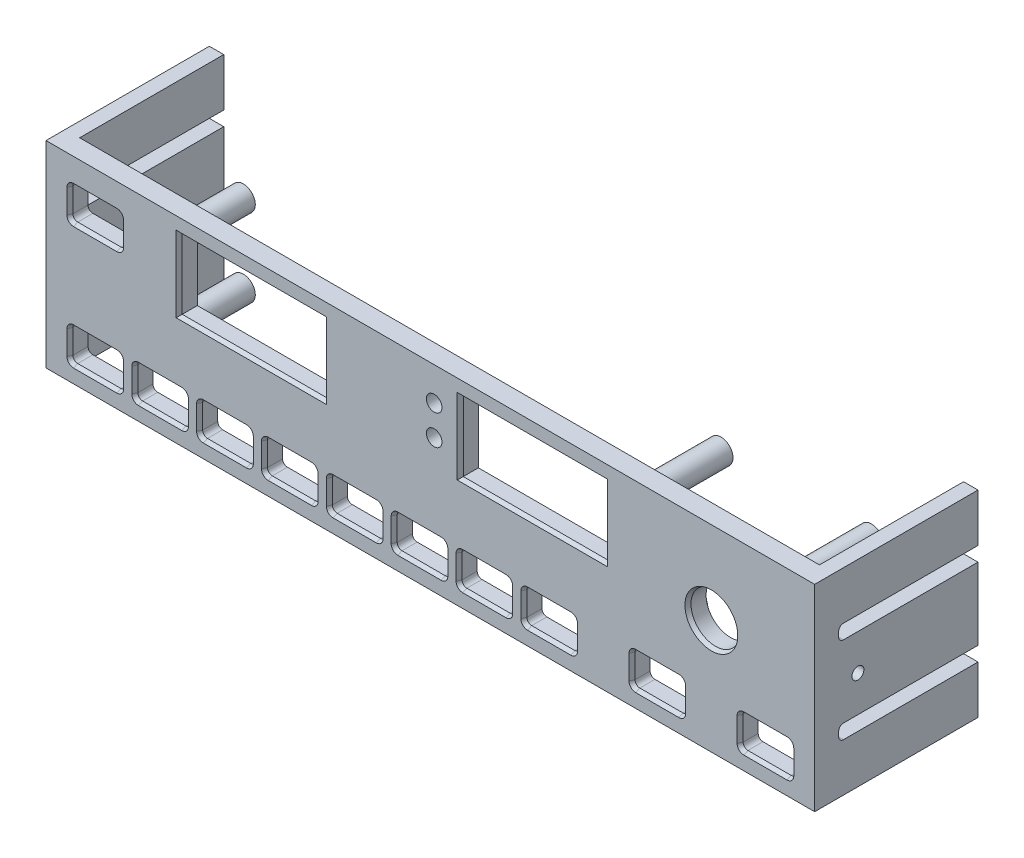
from build123d import *

# Parameters (mm, degrees)
ESQUISSE1_W             = 160
ESQUISSE1_H             = 41
BOSS_EXTRU_1_DEPTH      = 4
ESQUISSE2_R             = 5.1
ESQUISSE2_R_2           = 1.625
ESQUISSE2_W             = 30.5
ESQUISSE2_H             = 15
ENL_V_MAT_EXTRU_1_DEPTH = 4
ESQUISSE4_W             = 3
ESQUISSE4_H             = 41
BOSS_EXTRU_2_DEPTH      = 30
ENL_V_MAT_EXTRU_2_DEPTH = 168.871975029
ESQUISSE7_R             = 2.5
ESQUISSE7_R_2           = 1.25
BOSS_EXTRU_3_DEPTH      = 15
CHANFREIN1_SIZE         = 0.4
CHANFREIN1_SIZE2        = 0.857802768
ESQUISSE9_R             = 1.25
ENL_V_MAT_EXTRU_3_DEPTH = 900


with BuildPart() as part:
    # Esquisse1 → Boss.-Extru.1 (new body)
    with BuildSketch(Plane.XY):
        with Locations((80, 20.5)):
            Rectangle(ESQUISSE1_W, ESQUISSE1_H)
    extrude(amount=BOSS_EXTRU_1_DEPTH)

    # Esquisse2 → Enlèv. mat.-Extru.1 (cut)
    with BuildSketch(Plane.XY.offset(4)):
        with Locations((138.5, 23.75)):
            Circle(ESQUISSE2_R)
        with Locations((80.8, 34.05)):
            Circle(ESQUISSE2_R_2)
        with Locations((80.8, 27.83)):
            Circle(ESQUISSE2_R_2)
        with BuildLine():
            Line((19.25, 10.25), (28.25, 10.25))
            ThreePointArc((28.25, 10.25), (28.957106781, 9.957106781), (29.25, 9.25))
            Line((29.25, 9.25), (29.25, 4.25))
            ThreePointArc((29.25, 4.25), (28.957106781, 3.542893219), (28.25, 3.25))
            Line((28.25, 3.25), (19.25, 3.25))
            ThreePointArc((19.25, 3.25), (18.542893219, 3.542893219), (18.25, 4.25))
            Line((18.25, 4.25), (18.25, 9.25))
            ThreePointArc((18.25, 9.25), (18.542893219, 9.957106781), (19.25, 10.25))
        make_face()
        with BuildLine():
            Line((5.75, 3.25), (14.75, 3.25))
            ThreePointArc((14.75, 3.25), (15.457106781, 3.542893219), (15.75, 4.25))
            Line((15.75, 4.25), (15.75, 9.25))
            ThreePointArc((15.75, 9.25), (15.457106781, 9.957106781), (14.75, 10.25))
            Line((14.75, 10.25), (5.75, 10.25))
            ThreePointArc((5.75, 10.25), (5.042893219, 9.957106781), (4.75, 9.25))
            Line((4.75, 9.25), (4.75, 4.25))
            ThreePointArc((4.75, 4.25), (5.042893219, 3.542893219), (5.75, 3.25))
        make_face()
        with BuildLine():
            Line((32.75, 10.25), (41.75, 10.25))
            ThreePointArc((41.75, 10.25), (42.457106781, 9.957106781), (42.75, 9.25))
            Line((42.75, 9.25), (42.75, 4.25))
            ThreePointArc((42.75, 4.25), (42.457106781, 3.542893219), (41.75, 3.25))
            Line((41.75, 3.25), (32.75, 3.25))
            ThreePointArc((32.75, 3.25), (32.042893219, 3.542893219), (31.75, 4.25))
            Line((31.75, 4.25), (31.75, 9.25))
            ThreePointArc((31.75, 9.25), (32.042893219, 9.957106781), (32.75, 10.25))
        make_face()
        with BuildLine():
            Line((46.25, 10.25), (55.25, 10.25))
            ThreePointArc((55.25, 10.25), (55.957106781, 9.957106781), (56.25, 9.25))
            Line((56.25, 9.25), (56.25, 4.25))
            ThreePointArc((56.25, 4.25), (55.957106781, 3.542893219), (55.25, 3.25))
            Line((55.25, 3.25), (46.25, 3.25))
            ThreePointArc((46.25, 3.25), (45.542893219, 3.542893219), (45.25, 4.25))
            Line((45.25, 4.25), (45.25, 9.25))
            ThreePointArc((45.25, 9.25), (45.542893219, 9.957106781), (46.25, 10.25))
        make_face()
        with BuildLine():
            Line((59.75, 10.25), (68.75, 10.25))
            ThreePointArc((68.75, 10.25), (69.457106781, 9.957106781), (69.75, 9.25))
            Line((69.75, 9.25), (69.75, 4.25))
            ThreePointArc((69.75, 4.25), (69.457106781, 3.542893219), (68.75, 3.25))
            Line((68.75, 3.25), (59.75, 3.25))
            ThreePointArc((59.75, 3.25), (59.042893219, 3.542893219), (58.75, 4.25))
            Line((58.75, 4.25), (58.75, 9.25))
            ThreePointArc((58.75, 9.25), (59.042893219, 9.957106781), (59.75, 10.25))
        make_face()
        with BuildLine():
            Line((73.25, 10.25), (82.25, 10.25))
            ThreePointArc((82.25, 10.25), (82.957106781, 9.957106781), (83.25, 9.25))
            Line((83.25, 9.25), (83.25, 4.25))
            ThreePointArc((83.25, 4.25), (82.957106781, 3.542893219), (82.25, 3.25))
            Line((82.25, 3.25), (73.25, 3.25))
            ThreePointArc((73.25, 3.25), (72.542893219, 3.542893219), (72.25, 4.25))
            Line((72.25, 4.25), (72.25, 9.25))
            ThreePointArc((72.25, 9.25), (72.542893219, 9.957106781), (73.25, 10.25))
        make_face()
        with BuildLine():
            Line((86.75, 10.25), (95.75, 10.25))
            ThreePointArc((95.75, 10.25), (96.457106781, 9.957106781), (96.75, 9.25))
            Line((96.75, 9.25), (96.75, 4.25))
            ThreePointArc((96.75, 4.25), (96.457106781, 3.542893219), (95.75, 3.25))
            Line((95.75, 3.25), (86.75, 3.25))
            ThreePointArc((86.75, 3.25), (86.042893219, 3.542893219), (85.75, 4.25))
            Line((85.75, 4.25), (85.75, 9.25))
            ThreePointArc((85.75, 9.25), (86.042893219, 9.957106781), (86.75, 10.25))
        make_face()
        with BuildLine():
            Line((100.25, 10.25), (109.25, 10.25))
            ThreePointArc((109.25, 10.25), (109.957106781, 9.957106781), (110.25, 9.25))
            Line((110.25, 9.25), (110.25, 4.25))
            ThreePointArc((110.25, 4.25), (109.957106781, 3.542893219), (109.25, 3.25))
            Line((109.25, 3.25), (100.25, 3.25))
            ThreePointArc((100.25, 3.25), (99.542893219, 3.542893219), (99.25, 4.25))
            Line((99.25, 4.25), (99.25, 9.25))
            ThreePointArc((99.25, 9.25), (99.542893219, 9.957106781), (100.25, 10.25))
        make_face()
        with BuildLine():
            Line((122.75, 3.25), (131.75, 3.25))
            ThreePointArc((131.75, 3.25), (132.457106781, 3.542893219), (132.75, 4.25))
            Line((132.75, 4.25), (132.75, 9.25))
            ThreePointArc((132.75, 9.25), (132.457106781, 9.957106781), (131.75, 10.25))
            Line((131.75, 10.25), (122.75, 10.25))
            ThreePointArc((122.75, 10.25), (122.042893219, 9.957106781), (121.75, 9.25))
            Line((121.75, 9.25), (121.75, 4.25))
            ThreePointArc((121.75, 4.25), (122.042893219, 3.542893219), (122.75, 3.25))
        make_face()
        with BuildLine():
            Line((145.25, 3.25), (154.25, 3.25))
            ThreePointArc((154.25, 3.25), (154.957106781, 3.542893219), (155.25, 4.25))
            Line((155.25, 4.25), (155.25, 9.25))
            ThreePointArc((155.25, 9.25), (154.957106781, 9.957106781), (154.25, 10.25))
            Line((154.25, 10.25), (145.25, 10.25))
            ThreePointArc((145.25, 10.25), (144.542893219, 9.957106781), (144.25, 9.25))
            Line((144.25, 9.25), (144.25, 4.25))
            ThreePointArc((144.25, 4.25), (144.542893219, 3.542893219), (145.25, 3.25))
        make_face()
        with BuildLine():
            Line((5.75, 35.75), (14.75, 35.75))
            ThreePointArc((14.75, 35.75), (15.457106781, 35.457106781), (15.75, 34.75))
            Line((15.75, 34.75), (15.75, 29.75))
            ThreePointArc((15.75, 29.75), (15.457106781, 29.042893219), (14.75, 28.75))
            Line((14.75, 28.75), (5.75, 28.75))
            ThreePointArc((5.75, 28.75), (5.042893219, 29.042893219), (4.75, 29.75))
            Line((4.75, 29.75), (4.75, 34.75))
            ThreePointArc((4.75, 34.75), (5.042893219, 35.457106781), (5.75, 35.75))
        make_face()
        with Locations((42.75, 30.5)):
            Rectangle(ESQUISSE2_W, ESQUISSE2_H)
        with Locations((101.25, 30.5)):
            Rectangle(ESQUISSE2_W, ESQUISSE2_H)
    extrude(amount=-ENL_V_MAT_EXTRU_1_DEPTH, mode=Mode.SUBTRACT)

    # Esquisse4 → Boss.-Extru.2 (add)
    with BuildSketch(Plane(origin=(0, 0, 0), x_dir=(-1, 0, 0), z_dir=(0, 0, -1))):
        with Locations((-158.5, 20.5)):
            Rectangle(ESQUISSE4_W, ESQUISSE4_H)
        with Locations((-1.5, 20.5)):
            Rectangle(ESQUISSE4_W, ESQUISSE4_H)
    extrude(amount=BOSS_EXTRU_2_DEPTH)

    # Esquisse5 → Enlèv. mat.-Extru.2 (cut, through all)
    with BuildSketch(Plane(origin=(160, 0, 0), x_dir=(0, 0, -1), z_dir=(1, 0, 0))):
        with BuildLine():
            Line((30, 13), (2, 13))
            ThreePointArc((2, 13), (1.292893219, 12.707106781), (1, 12))
            Line((1, 12), (1, 11))
            ThreePointArc((1, 11), (1.292893219, 10.292893219), (2, 10))
            Line((2, 10), (30, 10))
            Line((30, 10), (30, 13))
        make_face()
        with BuildLine():
            Line((30, 31), (2, 31))
            ThreePointArc((2, 31), (1.292893219, 30.707106781), (1, 30))
            Line((1, 30), (1, 29))
            ThreePointArc((1, 29), (1.292893219, 28.292893219), (2, 28))
            Line((2, 28), (30, 28))
            Line((30, 28), (30, 31))
        make_face()
    extrude(amount=-ENL_V_MAT_EXTRU_2_DEPTH, mode=Mode.SUBTRACT)

    # Esquisse7 → Boss.-Extru.3 (add)
    # profile 1 of 7: a face of its own
    with BuildSketch(Plane(origin=(0, 0, 0), x_dir=(-1, 0, 0), z_dir=(0, 0, -1))):
        with Locations((-22.066417501, 32.220467417)):
            Circle(ESQUISSE7_R)
        with Locations((-22.066417501, 32.220467417)):
            Circle(ESQUISSE7_R_2, mode=Mode.SUBTRACT)
    # profile 2 of 7: a face of its own
    with BuildSketch(Plane(origin=(0, 0, 0), x_dir=(-1, 0, 0), z_dir=(0, 0, -1))):
        with Locations((-22.066417501, 15.960655172)):
            Circle(ESQUISSE7_R)
        with Locations((-22.066417501, 15.960655172)):
            Circle(ESQUISSE7_R_2, mode=Mode.SUBTRACT)
    # profile 3 of 7: a face of its own
    with BuildSketch(Plane(origin=(0, 0, 0), x_dir=(-1, 0, 0), z_dir=(0, 0, -1))):
        with Locations((-152.81245368, 36.297265299)):
            Circle(ESQUISSE7_R)
        with Locations((-152.81245368, 36.297265299)):
            Circle(ESQUISSE7_R_2, mode=Mode.SUBTRACT)
    # profile 4 of 7: a face of its own
    with BuildSketch(Plane(origin=(0, 0, 0), x_dir=(-1, 0, 0), z_dir=(0, 0, -1))):
        with Locations((-152.81245368, 14.495559759)):
            Circle(ESQUISSE7_R)
        with Locations((-152.81245368, 14.495559759)):
            Circle(ESQUISSE7_R_2, mode=Mode.SUBTRACT)
    # profile 5 of 7: a face of its own
    with BuildSketch(Plane(origin=(0, 0, 0), x_dir=(-1, 0, 0), z_dir=(0, 0, -1))):
        with Locations((-121.5, 36.297265299)):
            Circle(ESQUISSE7_R)
        with Locations((-121.5, 36.297265299)):
            Circle(ESQUISSE7_R_2, mode=Mode.SUBTRACT)
    # profile 6 of 7: a face of its own
    with BuildSketch(Plane(origin=(0, 0, 0), x_dir=(-1, 0, 0), z_dir=(0, 0, -1))):
        with Locations((-116.25, 6.75)):
            Circle(ESQUISSE7_R)
        with Locations((-116.25, 6.75)):
            Circle(ESQUISSE7_R_2, mode=Mode.SUBTRACT)
    # profile 7 of 7: a face of its own
    with BuildSketch(Plane(origin=(0, 0, 0), x_dir=(-1, 0, 0), z_dir=(0, 0, -1))):
        with Locations((-63.5, 14.495559759)):
            Circle(ESQUISSE7_R)
        with Locations((-63.5, 14.495559759)):
            Circle(ESQUISSE7_R_2, mode=Mode.SUBTRACT)
    extrude(amount=BOSS_EXTRU_3_DEPTH)

    # Chanfrein1
    chanfrein1_edges = [part.edges().sort_by_distance(p)[0] for p in [
        (101.25, 38, 4),
        (116.5, 30.5, 4),
        (101.25, 23, 4),
        (86, 30.5, 4),
        (58, 30.5, 4),
        (42.75, 23, 4),
        (27.5, 30.5, 4),
        (42.75, 38, 4),
        (133.4, 23.75, 4),
        (149.75, 3.25, 4),
        (154.957106781, 3.542893219, 4),
        (144.542893219, 3.542893219, 4),
        (155.25, 6.75, 4),
        (144.25, 6.75, 4),
        (154.957106781, 9.957106781, 4),
        (144.542893219, 9.957106781, 4),
        (149.75, 10.25, 4),
        (127.25, 3.25, 4),
        (132.457106781, 3.542893219, 4),
        (122.042893219, 3.542893219, 4),
        (132.75, 6.75, 4),
        (121.75, 6.75, 4),
        (132.457106781, 9.957106781, 4),
        (122.042893219, 9.957106781, 4),
        (127.25, 10.25, 4),
        (104.75, 3.25, 4),
        (109.957106781, 3.542893219, 4),
        (99.542893219, 3.542893219, 4),
        (110.25, 6.75, 4),
        (99.25, 6.75, 4),
        (109.957106781, 9.957106781, 4),
        (99.542893219, 9.957106781, 4),
        (104.75, 10.25, 4),
        (91.25, 3.25, 4),
        (96.457106781, 3.542893219, 4),
        (86.042893219, 3.542893219, 4),
        (96.75, 6.75, 4),
        (85.75, 6.75, 4),
        (96.457106781, 9.957106781, 4),
        (86.042893219, 9.957106781, 4),
        (91.25, 10.25, 4),
        (77.75, 3.25, 4),
        (82.957106781, 3.542893219, 4),
        (72.542893219, 3.542893219, 4),
        (83.25, 6.75, 4),
        (72.25, 6.75, 4),
        (82.957106781, 9.957106781, 4),
        (72.542893219, 9.957106781, 4),
        (77.75, 10.25, 4),
        (64.25, 3.25, 4),
        (69.457106781, 3.542893219, 4),
        (59.042893219, 3.542893219, 4),
        (69.75, 6.75, 4),
        (58.75, 6.75, 4),
        (69.457106781, 9.957106781, 4),
        (59.042893219, 9.957106781, 4),
        (64.25, 10.25, 4),
        (50.75, 3.25, 4),
        (55.957106781, 3.542893219, 4),
        (45.542893219, 3.542893219, 4),
        (56.25, 6.75, 4),
        (45.25, 6.75, 4),
        (55.957106781, 9.957106781, 4),
        (45.542893219, 9.957106781, 4),
        (50.75, 10.25, 4),
        (37.25, 3.25, 4),
        (42.457106781, 3.542893219, 4),
        (32.042893219, 3.542893219, 4),
        (42.75, 6.75, 4),
        (31.75, 6.75, 4),
        (42.457106781, 9.957106781, 4),
        (32.042893219, 9.957106781, 4),
        (37.25, 10.25, 4),
        (23.75, 3.25, 4),
        (28.957106781, 3.542893219, 4),
        (18.542893219, 3.542893219, 4),
        (29.25, 6.75, 4),
        (18.25, 6.75, 4),
        (28.957106781, 9.957106781, 4),
        (18.542893219, 9.957106781, 4),
        (23.75, 10.25, 4),
        (10.25, 3.25, 4),
        (15.457106781, 3.542893219, 4),
        (5.042893219, 3.542893219, 4),
        (15.75, 6.75, 4),
        (4.75, 6.75, 4),
        (15.457106781, 9.957106781, 4),
        (5.042893219, 9.957106781, 4),
        (10.25, 10.25, 4),
        (10.25, 35.75, 4),
        (5.042893219, 35.457106781, 4),
        (15.457106781, 35.457106781, 4),
        (4.75, 32.25, 4),
        (15.75, 32.25, 4),
        (5.042893219, 29.042893219, 4),
        (15.457106781, 29.042893219, 4),
        (10.25, 28.75, 4),
    ]]
    chanfrein1_side = [part.faces().sort_by_distance(p)[0] for p in [
        (82.682937433, 20.497031932, 4),
    ]]
    chamfer(chanfrein1_edges, length=CHANFREIN1_SIZE, length2=CHANFREIN1_SIZE2, reference=chanfrein1_side[0])

    # Esquisse9 → Enlèv. mat.-Extru.3 (cut)
    with BuildSketch(Plane(origin=(160, 0, 0), x_dir=(0, 0, -1), z_dir=(1, 0, 0))):
        with Locations((5, 20.5)):
            Circle(ESQUISSE9_R)
    extrude(amount=-ENL_V_MAT_EXTRU_3_DEPTH, mode=Mode.SUBTRACT)


solid = part.part
